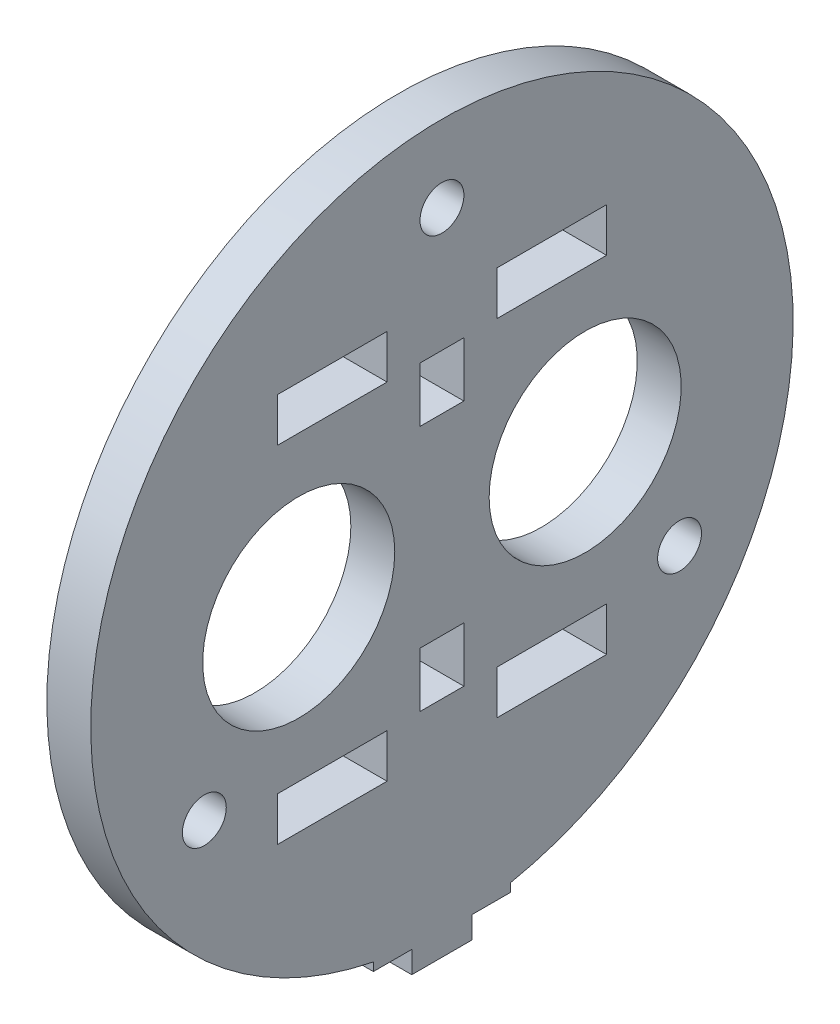
from build123d import *

# Parameters (mm, degrees)
SKETCH1_R           = 4
SKETCH1_R_2         = 17.5
BOSS_EXTRUDE1_DEPTH = 8
CUT_EXTRUDE1_REACH  = 95.934
SKETCH2_W           = 20
SKETCH2_H           = 8
SKETCH2_W_2         = 8
SKETCH2_H_2         = 10
SKETCH2_W_3         = 7
SKETCH2_H_3         = 4


with BuildPart() as part:
    # Sketch1 → Boss-Extrude1 (new body)
    with BuildSketch(Plane(origin=(0, 0, 0), x_dir=(0, 0, -1), z_dir=(1, 0, 0))):
        with BuildLine():
            Line((-12.5, -62.767427859), (-12.5, -68.29))
            Line((-12.5, -68.29), (12.5, -68.29))
            Line((12.5, -68.29), (12.5, -62.767427859))
            ThreePointArc((12.5, -62.767427859), (0, 64), (-12.5, -62.767427859))
        make_face()
        with Locations((0, 50)):
            Circle(SKETCH1_R, mode=Mode.SUBTRACT)
        with Locations((43.301270189, -25)):
            Circle(SKETCH1_R, mode=Mode.SUBTRACT)
        with Locations((-43.301270189, -25)):
            Circle(SKETCH1_R, mode=Mode.SUBTRACT)
        with Locations((-26.1, 0)):
            Circle(SKETCH1_R_2, mode=Mode.SUBTRACT)
        with Locations((26.1, 0)):
            Circle(SKETCH1_R_2, mode=Mode.SUBTRACT)
    extrude(amount=BOSS_EXTRUDE1_DEPTH)

    # Sketch2 → Cut-Extrude1 (cut, up to next)
    with BuildSketch(Plane.ZY, mode=Mode.PRIVATE) as cut_extrude1_sk1:
        with Locations((20, -31.5)):
            Rectangle(SKETCH2_W, SKETCH2_H)
    cut_extrude1_tool1 = extrude(cut_extrude1_sk1.sketch, amount=-CUT_EXTRUDE1_REACH, mode=Mode.PRIVATE) & part.part
    # Sketch2 → Cut-Extrude1 (cut, up to next)
    with BuildSketch(Plane.ZY, mode=Mode.PRIVATE) as cut_extrude1_sk2:
        with Locations((-20, -31.5)):
            Rectangle(SKETCH2_W, SKETCH2_H)
    cut_extrude1_tool2 = extrude(cut_extrude1_sk2.sketch, amount=-CUT_EXTRUDE1_REACH, mode=Mode.PRIVATE) & part.part
    # Sketch2 → Cut-Extrude1 (cut, up to next)
    with BuildSketch(Plane.ZY, mode=Mode.PRIVATE) as cut_extrude1_sk3:
        with Locations((20, 31.5)):
            Rectangle(SKETCH2_W, SKETCH2_H)
    cut_extrude1_tool3 = extrude(cut_extrude1_sk3.sketch, amount=-CUT_EXTRUDE1_REACH, mode=Mode.PRIVATE) & part.part
    # Sketch2 → Cut-Extrude1 (cut, up to next)
    with BuildSketch(Plane.ZY, mode=Mode.PRIVATE) as cut_extrude1_sk4:
        with Locations((-20, 31.5)):
            Rectangle(SKETCH2_W, SKETCH2_H)
    cut_extrude1_tool4 = extrude(cut_extrude1_sk4.sketch, amount=-CUT_EXTRUDE1_REACH, mode=Mode.PRIVATE) & part.part
    # Sketch2 → Cut-Extrude1 (cut, up to next)
    with BuildSketch(Plane.ZY, mode=Mode.PRIVATE) as cut_extrude1_sk5:
        with Locations((0, 22.5)):
            Rectangle(SKETCH2_W_2, SKETCH2_H_2)
    cut_extrude1_tool5 = extrude(cut_extrude1_sk5.sketch, amount=-CUT_EXTRUDE1_REACH, mode=Mode.PRIVATE) & part.part
    # Sketch2 → Cut-Extrude1 (cut, up to next)
    with BuildSketch(Plane.ZY, mode=Mode.PRIVATE) as cut_extrude1_sk6:
        with Locations((0, -22.5)):
            Rectangle(SKETCH2_W_2, SKETCH2_H_2)
    cut_extrude1_tool6 = extrude(cut_extrude1_sk6.sketch, amount=-CUT_EXTRUDE1_REACH, mode=Mode.PRIVATE) & part.part
    # Sketch2 → Cut-Extrude1 (cut, up to next)
    with BuildSketch(Plane.ZY, mode=Mode.PRIVATE) as cut_extrude1_sk7:
        with Locations((9, -66.29)):
            Rectangle(SKETCH2_W_3, SKETCH2_H_3)
    cut_extrude1_tool7 = extrude(cut_extrude1_sk7.sketch, amount=-CUT_EXTRUDE1_REACH, mode=Mode.PRIVATE) & part.part
    # Sketch2 → Cut-Extrude1 (cut, up to next)
    with BuildSketch(Plane.ZY, mode=Mode.PRIVATE) as cut_extrude1_sk8:
        with Locations((-9, -66.29)):
            Rectangle(SKETCH2_W_3, SKETCH2_H_3)
    cut_extrude1_tool8 = extrude(cut_extrude1_sk8.sketch, amount=-CUT_EXTRUDE1_REACH, mode=Mode.PRIVATE) & part.part
    add(cut_extrude1_tool1.solids().sort_by_distance((0, -31.5, 20))[0], mode=Mode.SUBTRACT)
    add(cut_extrude1_tool2.solids().sort_by_distance((0, -31.5, -20))[0], mode=Mode.SUBTRACT)
    add(cut_extrude1_tool3.solids().sort_by_distance((0, 31.5, 20))[0], mode=Mode.SUBTRACT)
    add(cut_extrude1_tool4.solids().sort_by_distance((0, 31.5, -20))[0], mode=Mode.SUBTRACT)
    add(cut_extrude1_tool5.solids().sort_by_distance((0, 22.5, 0))[0], mode=Mode.SUBTRACT)
    add(cut_extrude1_tool6.solids().sort_by_distance((0, -22.5, 0))[0], mode=Mode.SUBTRACT)
    add(cut_extrude1_tool7.solids().sort_by_distance((0, -66.29, 9))[0], mode=Mode.SUBTRACT)
    add(cut_extrude1_tool8.solids().sort_by_distance((0, -66.29, -9))[0], mode=Mode.SUBTRACT)


solid = part.part
